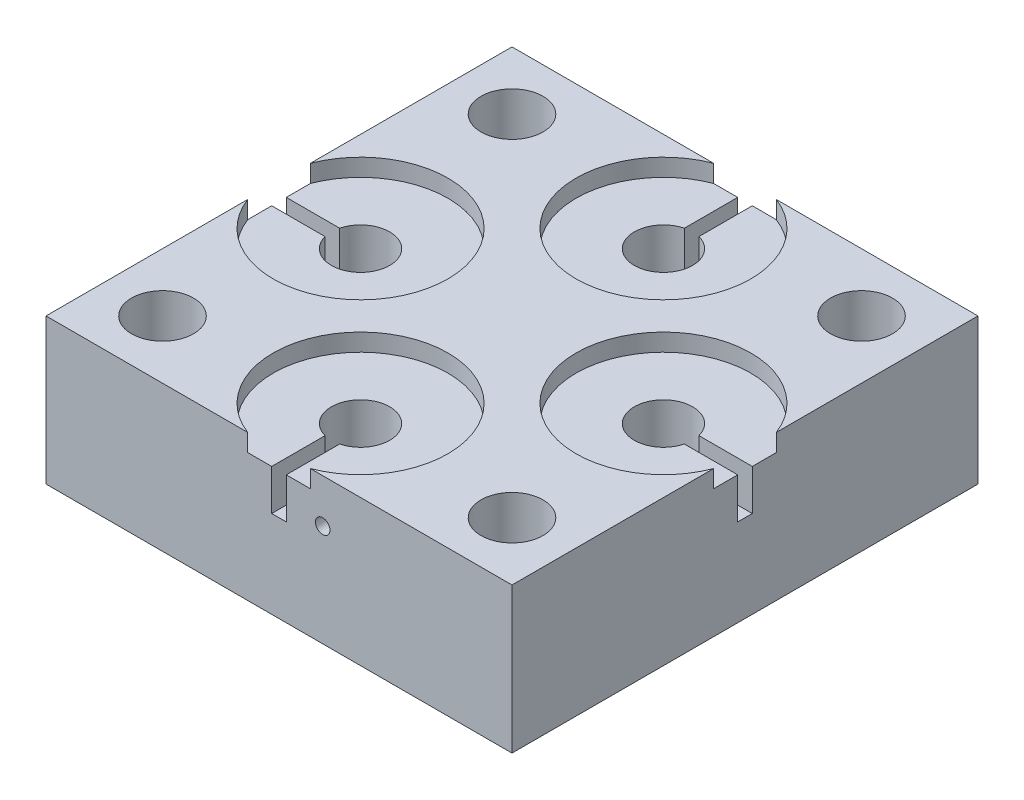
from build123d import *

# Parameters (mm, degrees)
SKETCH1_W               = 50.8
SKETCH1_H               = 50.8
BOSS_EXTRUDE1_DEPTH     = 15.875
F_1_4_CLEARANCE_HOLE1_D = 6.7564
SKETCH7_R               = 3.175
CUT_EXTRUDE2_DEPTH      = 9.525
F_6_CLEARANCE_HOLE1_D   = 3.7973
SKETCH15_R              = 6.35
CUT_EXTRUDE5_DEPTH      = 3.175
SKETCH17_R              = 0.79375
CUT_EXTRUDE7_DEPTH      = 19.05
SKETCH19_R              = 0.79375
CUT_EXTRUDE8_DEPTH      = 19.05
SKETCH20_W              = 1.5875
SKETCH20_H              = 8.919384601
SKETCH20_W_2            = 8.609080127
SKETCH20_H_2            = 1.5875
SKETCH20_W_3            = 9.022819426
SKETCH20_H_3            = 8.367732203
CUT_EXTRUDE9_DEPTH      = 6.35
SKETCH21_R              = 9.525
CUT_EXTRUDE10_DEPTH     = 1.905


with BuildPart() as part:
    # Sketch1 → Boss-Extrude1 (new body)
    with BuildSketch(Plane(origin=(0, 0, 0), x_dir=(1, 0, 0), z_dir=(0, 1, 0))):
        Rectangle(SKETCH1_W, SKETCH1_H)
    extrude(amount=BOSS_EXTRUDE1_DEPTH)

    # 1/4 Clearance Hole1 (through all)
    with Locations(Plane(origin=(0, 15.875, 0), x_dir=(1, 0, 0), z_dir=(0, 1, 0))):
        with Locations((-19.05, -19.05), (-19.05, 19.05), (19.05, 19.05), (19.05, -19.05)):
            Hole(F_1_4_CLEARANCE_HOLE1_D / 2)

    # Sketch7 → Cut-Extrude2 (cut)
    with BuildSketch(Plane(origin=(0, 15.875, 0), x_dir=(1, 0, 0), z_dir=(0, 1, 0))):
        with Locations((-16.51, 0)):
            Circle(SKETCH7_R)
        with Locations((0, 16.51)):
            Circle(SKETCH7_R)
        with Locations((16.51, 0)):
            Circle(SKETCH7_R)
        with Locations((0, -16.51)):
            Circle(SKETCH7_R)
    extrude(amount=-CUT_EXTRUDE2_DEPTH, mode=Mode.SUBTRACT)

    # #6 Clearance Hole1 (through all)
    with Locations(Plane(origin=(0, 6.35, 0), x_dir=(1, 0, 0), z_dir=(0, 1, 0))):
        with Locations((-16.51, 0), (0, 16.51), (16.51, 0), (0, -16.51)):
            Hole(F_6_CLEARANCE_HOLE1_D / 2)

    # Sketch15 → Cut-Extrude5 (cut)
    with BuildSketch(Plane.XZ):
        with Locations((0, 16.51)):
            Circle(SKETCH15_R)
        with Locations((16.51, 0)):
            Circle(SKETCH15_R)
        with Locations((0, -16.51)):
            Circle(SKETCH15_R)
        with Locations((-16.51, 0)):
            Circle(SKETCH15_R)
    extrude(amount=-CUT_EXTRUDE5_DEPTH, mode=Mode.SUBTRACT)

    # Sketch17 → Cut-Extrude7 (cut)
    with BuildSketch(Plane.XY.offset(25.4)):
        with Locations((4.7625, 11.1125)):
            Circle(SKETCH17_R)
    extrude(amount=-CUT_EXTRUDE7_DEPTH, mode=Mode.SUBTRACT)

    # Sketch19 → Cut-Extrude8 (cut)
    with BuildSketch(Plane(origin=(0, 0, -25.4), x_dir=(-1, 0, 0), z_dir=(0, 0, -1))):
        with Locations((4.7625, 11.1125)):
            Circle(SKETCH19_R)
    extrude(amount=-CUT_EXTRUDE8_DEPTH, mode=Mode.SUBTRACT)

    # Sketch20 → Cut-Extrude9 (cut)
    with BuildSketch(Plane(origin=(0, 15.875, 0), x_dir=(1, 0, 0), z_dir=(0, 1, 0))):
        with Locations((0, 20.9403077)):
            Rectangle(SKETCH20_W, SKETCH20_H)
        with Locations((-21.095459936, 0)):
            Rectangle(SKETCH20_W_2, SKETCH20_H_2)
        with Locations((20.888590287, 0)):
            Rectangle(SKETCH20_W_3, SKETCH20_H_2)
        with Locations((0, -21.216133899)):
            Rectangle(SKETCH20_W, SKETCH20_H_3)
    extrude(amount=-CUT_EXTRUDE9_DEPTH, mode=Mode.SUBTRACT)

    # Sketch21 → Cut-Extrude10 (cut)
    with BuildSketch(Plane(origin=(0, 15.875, 0), x_dir=(1, 0, 0), z_dir=(0, 1, 0))):
        with Locations((-16.51, 0)):
            Circle(SKETCH21_R)
        with Locations((16.51, 0)):
            Circle(SKETCH21_R)
        with Locations((0, 16.51)):
            Circle(SKETCH21_R)
        with Locations((0, -16.51)):
            Circle(SKETCH21_R)
    extrude(amount=-CUT_EXTRUDE10_DEPTH, mode=Mode.SUBTRACT)


solid = part.part
